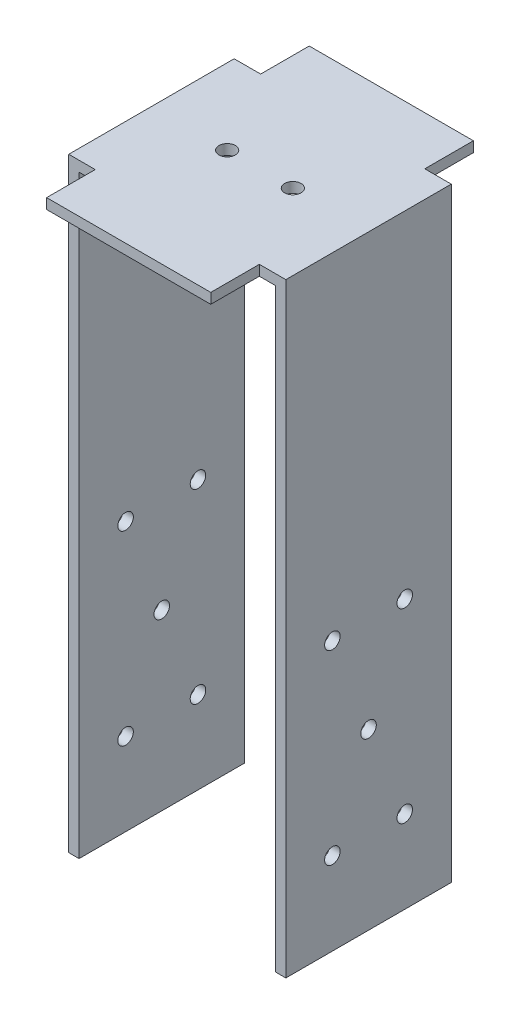
from build123d import *

# Parameters (mm, degrees)
BOSS_EXTRUDE1_DEPTH = 2
SKETCH2_W           = 2
SKETCH2_H           = 32
BOSS_EXTRUDE2_DEPTH = 115
SKETCH3_R           = 1.5
CUT_EXTRUDE1_DEPTH  = 127.878524582
SKETCH4_R           = 1.5875
CUT_EXTRUDE2_DEPTH  = 122.553115962


with BuildPart() as part:
    # Sketch1 → Boss-Extrude1 (new body)
    with BuildSketch(Plane(origin=(0, 0, 0), x_dir=(1, 0, 0), z_dir=(0, 1, 0))):
        Polygon((-21, 16), (-15.875, 16), (-15.875, 25.4), (15.875, 25.4), (15.875, 16), (21, 16), (21, -16), (15.875, -16), (15.875, -25.4), (-15.875, -25.4), (-15.875, -16), (-21, -16), align=None)
    extrude(amount=-BOSS_EXTRUDE1_DEPTH)

    # Sketch2 → Boss-Extrude2 (add)
    with BuildSketch(Plane.XZ.offset(2)):
        with Locations((-20, 0)):
            Rectangle(SKETCH2_W, SKETCH2_H)
        with Locations((20, 0)):
            Rectangle(SKETCH2_W, SKETCH2_H)
    extrude(amount=BOSS_EXTRUDE2_DEPTH)

    # Sketch3 → Cut-Extrude1 (cut, through all)
    with BuildSketch(Plane.ZY.offset(21)):
        with Locations((-7, -65)):
            Circle(SKETCH3_R)
        with Locations((7, -65)):
            Circle(SKETCH3_R)
        with Locations((7, -101)):
            Circle(SKETCH3_R)
        with Locations((-7, -101)):
            Circle(SKETCH3_R)
        with Locations((0, -83.336478267)):
            Circle(SKETCH3_R)
    extrude(amount=-CUT_EXTRUDE1_DEPTH, mode=Mode.SUBTRACT)

    # Sketch4 → Cut-Extrude2 (cut, through all)
    with BuildSketch(Plane(origin=(0, 0, 0), x_dir=(1, 0, 0), z_dir=(0, 1, 0))):
        with Locations((-6.35, 0)):
            Circle(SKETCH4_R)
        with Locations((6.35, 0)):
            Circle(SKETCH4_R)
    extrude(amount=-CUT_EXTRUDE2_DEPTH, mode=Mode.SUBTRACT)


solid = part.part
